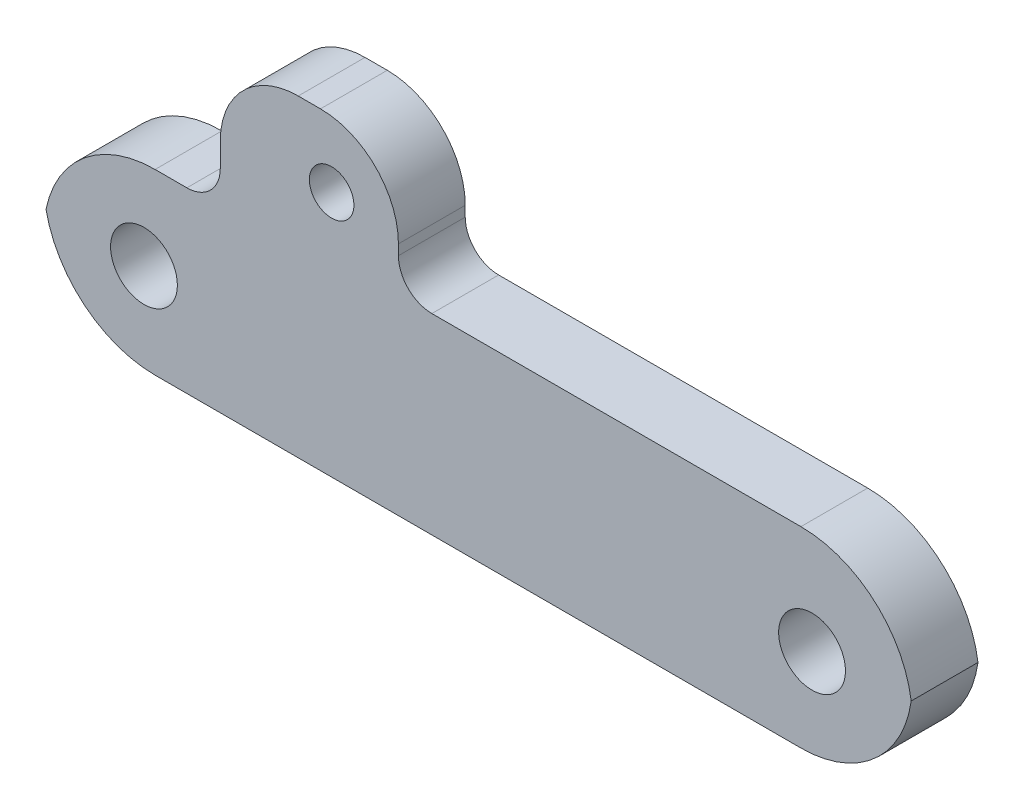
from build123d import *

# Parameters (mm, degrees)
SKETCH1_R           = 1.5
SKETCH1_R_2         = 1
BOSS_EXTRUDE1_DEPTH = 3
FILLET1_R           = 5
FILLET2_R           = 3.5
FILLET3_R           = 1.5


with BuildPart() as part:
    # Sketch1 → Boss-Extrude1 (new body)
    with BuildSketch(Plane.XY):
        Polygon((0, 0), (39, 0), (39, 8.610580904), (15.926488874, 8.610580904), (15.926488874, 14.070663707), (7.926488874, 14.070663707), (7.926488874, 8), (0, 8), align=None)
        with Locations((4.5, 4)):
            Circle(SKETCH1_R, mode=Mode.SUBTRACT)
        with Locations((34.5, 4)):
            Circle(SKETCH1_R, mode=Mode.SUBTRACT)
        with Locations((12.926488874, 11.070663707)):
            Circle(SKETCH1_R_2, mode=Mode.SUBTRACT)
    extrude(amount=BOSS_EXTRUDE1_DEPTH)

    # Fillet1
    # the kernel refuses this fillet: 5 mm, written as the material it takes off along each edge
    with BuildSketch(Plane(origin=(39, 8.610580904, -12.5), x_dir=(0, -1, 0), z_dir=(0, 0, 1)), Plane(origin=(39, 0, -12.5), x_dir=(-1, 0, 0), z_dir=(0, 0, 1)), Plane(origin=(0, 8, -12.5), x_dir=(1, 0, 0), z_dir=(0, 0, 1))) as fillet1_piece_1:
        with BuildLine():
            CenterArc((FILLET1_R, -FILLET1_R), FILLET1_R, 90, 90)
            Line((0, -FILLET1_R), (0, 0))
            Line((0, 0), (FILLET1_R, 0))
        make_face()
    extrude(amount=28, mode=Mode.SUBTRACT)
    with BuildSketch(Plane(origin=(0, 0, -12.5), x_dir=(1, 0, 0), z_dir=(0, 0, 1))) as fillet1_piece_2:
        with BuildLine():
            CenterArc((FILLET1_R, FILLET1_R), FILLET1_R, 180, 90)
            Line((0, FILLET1_R), (0, 0))
            Line((0, 0), (FILLET1_R, 0))
        make_face()
    extrude(amount=28, mode=Mode.SUBTRACT)

    # Fillet2
    fillet2_edges = [part.edges().sort_by_distance(p)[0] for p in [
        (7.926488874, 14.070663707, 1.5),
        (15.926488874, 14.070663707, 1.5),
    ]]
    fillet(fillet2_edges, radius=FILLET2_R)

    # Fillet3
    fillet3_edges = [part.edges().sort_by_distance(p)[0] for p in [
        (7.926488874, 8, 1.5),
        (15.926488874, 8.610580904, 1.5),
    ]]
    fillet(fillet3_edges, radius=FILLET3_R)


solid = part.part
